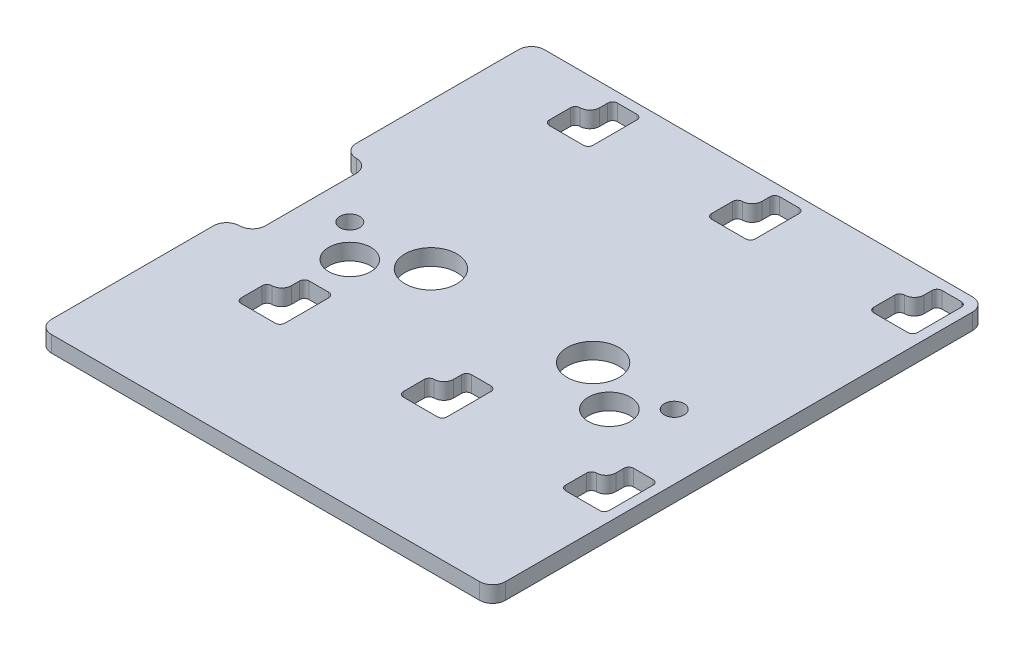
from build123d import *

# Parameters (mm, degrees)
SKETCH1_W              = 140
SKETCH1_H              = 152
BOSS_EXTRUDE1_DEPTH    = 5
SKETCH2_R              = 3.05
SKETCH2_R_2            = 8
SKETCH2_R_3            = 6.5
CUT_EXTRUDE1_DEPTH     = 104.445637897
SKETCH4_W              = 8
SKETCH4_H              = 36
CUT_EXTRUDE3_DEPTH     = 104.445637897
CUT_EXTRUDE2_DEPTH     = 104.445637897
FILLET3_R              = 1.5
LPATTERN1_COUNT        = 3
LPATTERN1_PITCH        = 50
FILLET3_OF_LPATTERN1_R = 1.5
LPATTERN4_DEPTH        = 5
FILLET1_R              = 4


# Read off the part's stored shape, not the designer's step: LPattern4
with BuildPart() as part:
    # Sketch1 → Boss-Extrude1 (new body)
    with BuildSketch(Plane(origin=(0, 0, 0), x_dir=(1, 0, 0), z_dir=(0, 1, 0))):
        Rectangle(SKETCH1_W, SKETCH1_H)
    extrude(amount=BOSS_EXTRUDE1_DEPTH)

    # Sketch2 → Cut-Extrude1 (cut, through all)
    with BuildSketch(Plane(origin=(0, 5, 0), x_dir=(1, 0, 0), z_dir=(0, 1, 0))):
        with Locations(Location((-50, 0, 0), (0, 0, 270))):
            Circle(SKETCH2_R)
        with Locations(Location((-25, 0, 0), (0, 0, 270))):
            Circle(SKETCH2_R_2)
        with Locations(Location((-40, -10, 0), (0, 0, 270))):
            Circle(SKETCH2_R_3)
    cut_extrude1 = extrude(amount=-CUT_EXTRUDE1_DEPTH, mode=Mode.SUBTRACT)

    # Mirror1: Cut-Extrude1 across plane
    add(cut_extrude1.mirror(Plane(origin=(0, 0, 0), x_dir=(0, 0, 1), z_dir=(1, 0, 0))), mode=Mode.SUBTRACT)

    # Sketch4 → Cut-Extrude3 (cut, through all)
    with BuildSketch(Plane(origin=(0, 5, 0), x_dir=(1, 0, 0), z_dir=(0, 1, 0))):
        with Locations((-66, 0)):
            Rectangle(SKETCH4_W, SKETCH4_H)
    extrude(amount=-CUT_EXTRUDE3_DEPTH, mode=Mode.SUBTRACT)

    # Sketch3 → Cut-Extrude2 (cut, through all)
    with BuildSketch(Plane(origin=(0, 5, 0), x_dir=(1, 0, 0), z_dir=(0, 1, 0))):
        with BuildLine():
            ThreePointArc((-42, -26), (-42.878679656, -28.121320344), (-45, -29))
            Line((-45, -29), (-46.5, -29))
            Line((-46.5, -29), (-46.5, -38.5))
            Line((-46.5, -38.5), (-33, -38.5))
            Line((-33, -38.5), (-33, -22))
            Line((-33, -22), (-42, -22))
            Line((-42, -22), (-42, -26))
        make_face()
    cut_extrude2 = extrude(amount=-CUT_EXTRUDE2_DEPTH, mode=Mode.SUBTRACT)

    # Fillet3
    fillet3_edges = [part.edges().sort_by_distance(p)[0] for p in [
        (-33, 2.5, 38.5),
        (-46.5, 2.5, 38.5),
        (-46.5, 2.5, 29),
        (-33, 2.5, 22),
        (-42, 2.5, 22),
    ]]
    fillet(fillet3_edges, radius=FILLET3_R - 0.0001)  # a hair under: the kernel refuses the full size

    # LPattern1: Cut-Extrude2 ×3
    with Locations(*[(i * LPATTERN1_PITCH, 0, 0) for i in range(1, LPATTERN1_COUNT)]):
        add(cut_extrude2, mode=Mode.SUBTRACT)

    # Fillet3 of LPattern1
    fillet3_of_lpattern1_edges = [part.edges().sort_by_distance(p)[0] for p in [
        (17, 2.5, 38.5),
        (3.5, 2.5, 38.5),
        (3.5, 2.5, 29),
        (17, 2.5, 22),
        (8, 2.5, 22),
        (67, 2.5, 38.5),
        (53.5, 2.5, 38.5),
        (53.5, 2.5, 29),
        (67, 2.5, 22),
        (58, 2.5, 22),
    ]]
    fillet(fillet3_of_lpattern1_edges, radius=FILLET3_OF_LPATTERN1_R - 0.0001)  # a hair under: the kernel refuses the full size

    # LPattern4 outline → LPattern4 (cut)
    with BuildSketch(Plane(origin=(0, 0, 0), x_dir=(1, 0, 0), z_dir=(0, 1, 0))):
        with BuildLine():
            ThreePointArc((65.5, 56.5), (66.560660172, 56.939339828), (67, 58))
            Line((67, 58), (67, 71.5))
            ThreePointArc((67, 71.5), (66.560660172, 72.560660172), (65.5, 73))
            Line((65.5, 73), (59.5, 73))
            ThreePointArc((59.5, 73), (58.439339828, 72.560660172), (58, 71.5))
            Line((58, 71.5), (58, 69))
            ThreePointArc((58, 69), (57.121320344, 66.878679656), (55, 66))
            ThreePointArc((55, 66), (53.939339828, 65.560660172), (53.5, 64.5))
            Line((53.5, 64.5), (53.5, 58))
            ThreePointArc((53.5, 58), (53.939339828, 56.939339828), (55, 56.5))
            Line((55, 56.5), (65.5, 56.5))
        make_face()
        with BuildLine():
            Line((-42, 71.5), (-42, 69))
            ThreePointArc((-42, 69), (-42.878679656, 66.878679656), (-45, 66))
            ThreePointArc((-45, 66), (-46.060660172, 65.560660172), (-46.5, 64.5))
            Line((-46.5, 64.5), (-46.5, 58))
            ThreePointArc((-46.5, 58), (-46.060660172, 56.939339828), (-45, 56.5))
            Line((-45, 56.5), (-34.5, 56.5))
            ThreePointArc((-34.5, 56.5), (-33.439339828, 56.939339828), (-33, 58))
            Line((-33, 58), (-33, 71.5))
            ThreePointArc((-33, 71.5), (-33.439339828, 72.560660172), (-34.5, 73))
            Line((-34.5, 73), (-40.5, 73))
            ThreePointArc((-40.5, 73), (-41.560660172, 72.560660172), (-42, 71.5))
        make_face()
        with BuildLine():
            Line((8, 71.5), (8, 69))
            ThreePointArc((8, 69), (7.121320344, 66.878679656), (5, 66))
            ThreePointArc((5, 66), (3.939339828, 65.560660172), (3.5, 64.5))
            Line((3.5, 64.5), (3.5, 58))
            ThreePointArc((3.5, 58), (3.939339828, 56.939339828), (5, 56.5))
            Line((5, 56.5), (15.5, 56.5))
            ThreePointArc((15.5, 56.5), (16.560660172, 56.939339828), (17, 58))
            Line((17, 58), (17, 71.5))
            ThreePointArc((17, 71.5), (16.560660172, 72.560660172), (15.5, 73))
            Line((15.5, 73), (9.5, 73))
            ThreePointArc((9.5, 73), (8.439339828, 72.560660172), (8, 71.5))
        make_face()
    extrude(amount=LPATTERN4_DEPTH, mode=Mode.SUBTRACT)

    # Fillet1
    fillet1_edges = [part.edges().sort_by_distance(p)[0] for p in [
        (-70, 2.5, -76),
        (70, 2.5, -76),
        (70, 2.5, 76),
        (-70, 2.5, 76),
        (-70, 2.5, 18),
        (-62, 2.5, 18),
        (-62, 2.5, -18),
        (-70, 2.5, -18),
    ]]
    fillet(fillet1_edges, radius=FILLET1_R - 0.0001)  # a hair under: the kernel refuses the full size


solid = part.part
